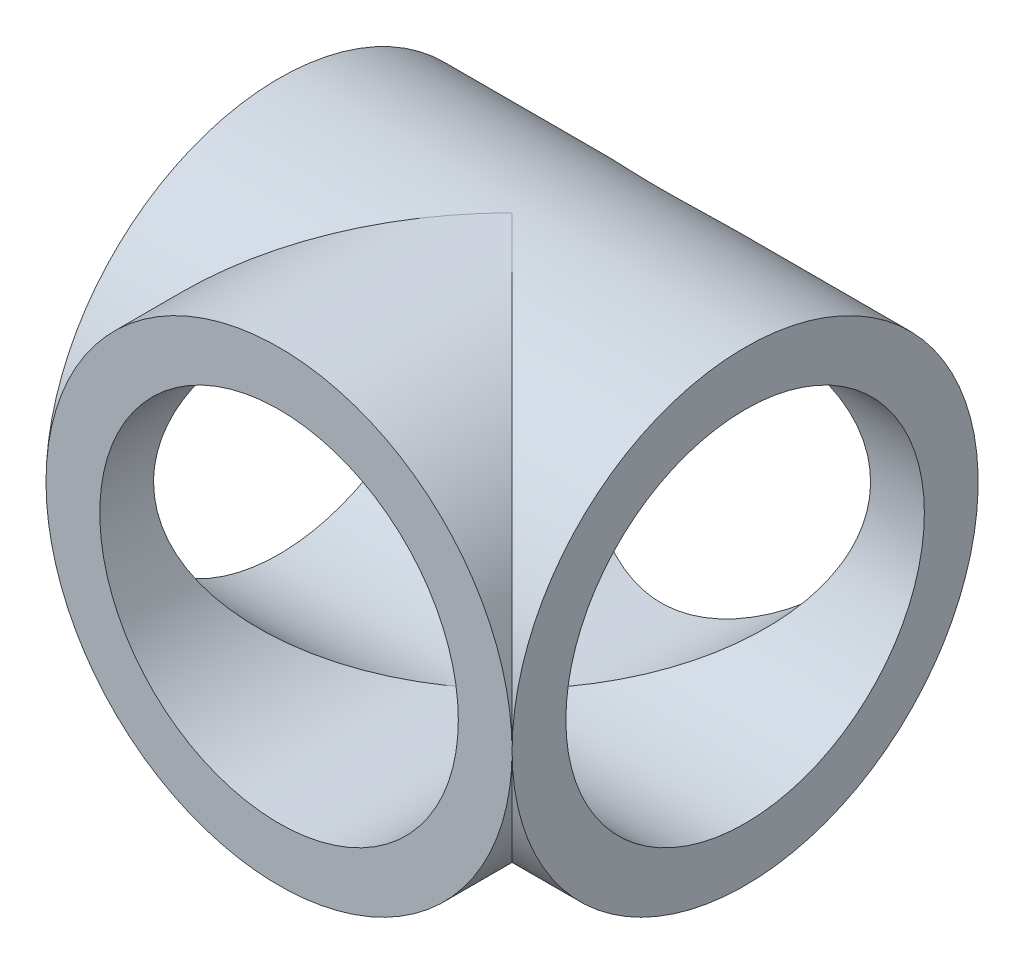
from build123d import *
from build123d.topology import SkipClean

# Parameters (mm, degrees)
BOSS_EXTRUDE4_DEPTH      = 13
BOSS_EXTRUDE4_DEPTH_BACK = 13
SKETCH46_R               = 13
SKETCH47_R               = 13
BOSS_EXTRUDE5_DEPTH      = 13
SKETCH48_R               = 10
CUT_EXTRUDE1_DEPTH       = 33
SKETCH49_R               = 10
CUT_EXTRUDE2_DEPTH       = 33


with BuildPart() as part:
    # Sketch46 → Boss-Extrude4 (new, two sides: drawn at the far end of the back side and taken through both)
    with BuildSketch(Plane(origin=(0, 0, 0), x_dir=(0, 0, -1), z_dir=(1, 0, 0)).offset(-BOSS_EXTRUDE4_DEPTH_BACK)):
        Circle(SKETCH46_R)
    extrude(amount=BOSS_EXTRUDE4_DEPTH + BOSS_EXTRUDE4_DEPTH_BACK)

    # Sketch47 → Boss-Extrude5 (add)
    with SkipClean():  # the faces are left unmerged after this step: merging them gives an invalid solid
        with BuildSketch(Plane.XY):
            Circle(SKETCH47_R)
        extrude(amount=BOSS_EXTRUDE5_DEPTH)

    # Sketch48 → Cut-Extrude1 (cut)
    with SkipClean():  # the faces are left unmerged after this step: merging them gives an invalid solid
        with BuildSketch(Plane.XY.offset(13)):
            Circle(SKETCH48_R)
        extrude(amount=-CUT_EXTRUDE1_DEPTH, mode=Mode.SUBTRACT)

    # Sketch49 → Cut-Extrude2 (cut)
    with SkipClean():  # the faces are left unmerged after this step: merging them gives an invalid solid
        with BuildSketch(Plane.ZY.offset(13)):
            Circle(SKETCH49_R)
        extrude(amount=-CUT_EXTRUDE2_DEPTH, mode=Mode.SUBTRACT)


solid = part.part
